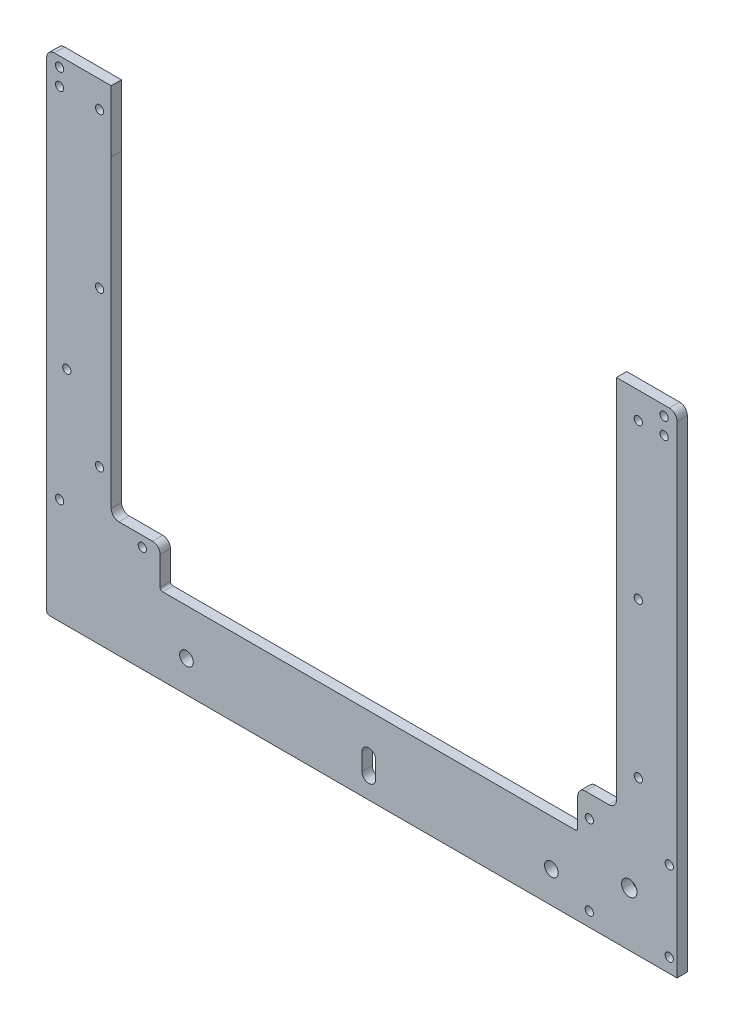
from build123d import *

# Parameters (mm, degrees)
RESSALTO_EXTRUS_O1_DEPTH = 4
FILETE1_R                = 3
M3_CLEARANCE_HOLE1_D     = 3.2
FURO_COM_FOLGA_DE_M32_D  = 2.87
M3_CLEARANCE_HOLE2_D     = 3.2
SKETCH3_W                = 27.430623534
SKETCH3_H                = 190
CUT_EXTRUDE1_DEPTH       = 10
BOSS_EXTRUDE1_DEPTH      = 4
FILLET3_R                = 3
BOSS_EXTRUDE3_DEPTH      = 4
M3_CLEARANCE_HOLE4_D     = 3.2
FILLET5_R                = 3
M5_CLEARANCE_HOLE1_D     = 5.3
SKETCH15_R               = 3
CUT_EXTRUDE6_DEPTH       = 215.251953603
SKETCH17_W               = 196
SKETCH17_H               = 23.942856981
CUT_EXTRUDE8_DEPTH       = 5
M3_CLEARANCE_HOLE6_D     = 3.2
M3_CLEARANCE_HOLE5_D     = 3.2
CUT_EXTRUDE9_DEPTH       = 4


with BuildPart() as part:
    # Esboço1 → Ressalto-extrusão1 (new body)
    with BuildSketch(Plane.XY):
        with BuildLine():
            Line((168.243612151, -138.115636704), (-79.756387849, -138.115636704))
            ThreePointArc((-79.756387849, -138.115636704), (-80.46349463, -137.822743485), (-80.756387849, -137.115636704))
            Line((-80.756387849, -137.115636704), (-80.756387849, 48.884363296))
            ThreePointArc((-80.756387849, 48.884363296), (-79.877708192, 51.005683639), (-77.756387849, 51.884363296))
            Line((-77.756387849, 51.884363296), (166.243612151, 51.884363296))
            ThreePointArc((166.243612151, 51.884363296), (168.364932495, 51.005683639), (169.243612151, 48.884363296))
            Line((169.243612151, 48.884363296), (169.243612151, -137.115636704))
            ThreePointArc((169.243612151, -137.115636704), (168.950718933, -137.822743485), (168.243612151, -138.115636704))
        make_face()
        with BuildLine():
            Line((-36.756387849, -93.115636704), (-55.756387849, -93.115636704))
            Line((-55.756387849, -93.115636704), (-55.756387849, -79.115636704))
            Line((-55.756387849, -79.115636704), (-55.756387849, 27.884363296))
            ThreePointArc((-55.756387849, 27.884363296), (-54.877708192, 30.005683639), (-52.756387849, 30.884363296))
            Line((-52.756387849, 30.884363296), (141.243612151, 30.884363296))
            ThreePointArc((141.243612151, 30.884363296), (143.364932495, 30.005683639), (144.243612151, 27.884363296))
            Line((144.243612151, 27.884363296), (144.243612151, -79.115636704))
            Line((144.243612151, -79.115636704), (144.243612151, -93.115636704))
            Line((144.243612151, -93.115636704), (125.243612151, -93.115636704))
            Line((125.243612151, -93.115636704), (125.243612151, -107.115636704))
            ThreePointArc((125.243612151, -107.115636704), (124.950718933, -107.822743485), (124.243612151, -108.115636704))
            Line((124.243612151, -108.115636704), (-35.756387849, -108.115636704))
            ThreePointArc((-35.756387849, -108.115636704), (-36.46349463, -107.822743485), (-36.756387849, -107.115636704))
            Line((-36.756387849, -107.115636704), (-36.756387849, -93.115636704))
        make_face(mode=Mode.SUBTRACT)
    extrude(amount=RESSALTO_EXTRUS_O1_DEPTH)

    # Filete1
    filete1_edges = [part.edges().sort_by_distance(p)[0] for p in [
        (144.243612151, -93.115636704, 2),
        (125.243612151, -93.115636704, 2),
        (-55.756387849, -93.115636704, 2),
        (-36.756387849, -93.115636704, 2),
    ]]
    fillet(filete1_edges, radius=FILETE1_R)

    # M3 Clearance Hole1 (through all)
    with Locations(Plane(origin=(0, 0, 0), x_dir=(-1, 0, 0), z_dir=(0, 0, -1))):
        with Locations((-164.230041881, -97.102981335), (43.669958119, -97.102981335), (75.742817578, -97.102981335)):
            Hole(M3_CLEARANCE_HOLE1_D / 2)

    # Furo com folga de M32 (through all)
    with Locations(Plane.XY.offset(4)):
        with Locations((44.243612151, 46.98714614)):
            Hole(FURO_COM_FOLGA_DE_M32_D / 2)

    # M3 Clearance Hole2 (through all)
    with Locations(Plane.XY.offset(4)):
        with Locations((161.560317261, 35.480164232), (161.560317261, 4.480164232)):
            Hole(M3_CLEARANCE_HOLE2_D / 2)

    # Sketch3 → Cut-Extrude1 (cut)
    with BuildSketch(Plane.XY.offset(4)):
        with Locations((169.958923918, -43.115636704)):
            Rectangle(SKETCH3_W, SKETCH3_H)
    extrude(amount=-CUT_EXTRUDE1_DEPTH, mode=Mode.SUBTRACT)

    # Sketch5 → Boss-Extrude1 (add)
    with BuildSketch(Plane(origin=(0, 0, 0), x_dir=(-1, 0, 0), z_dir=(0, 0, -1))):
        with BuildLine():
            Line((-145.240285588, -97.500155699), (-140.243612151, -97.500155699))
            Line((-140.243612151, -97.500155699), (-140.243612151, 27.941506315))
            ThreePointArc((-140.243612151, 27.941506315), (-139.345176524, 30.025791447), (-137.244156422, 30.884363296))
            Line((-137.244156422, 30.884363296), (-145.240285588, 30.884363296))
            Line((-145.240285588, 30.884363296), (-145.240285588, -97.500155699))
        make_face()
    extrude(amount=-BOSS_EXTRUDE1_DEPTH)

    # Fillet3
    fillet3_edges = [part.edges().sort_by_distance(p)[0] for p in [
        (156.243612151, 51.884363296, 2),
    ]]
    fillet(fillet3_edges, radius=FILLET3_R)

    # Sketch10 → Boss-Extrude3 (add)
    with BuildSketch(Plane(origin=(0, 0, 0), x_dir=(-1, 0, 0), z_dir=(0, 0, -1))):
        with BuildLine():
            Line((-156.243612151, -138.115636704), (-156.243612151, 48.884363296))
            ThreePointArc((-156.243612151, 48.884363296), (-155.364932495, 51.005683639), (-153.243612151, 51.884363296))
            Line((-153.243612151, 51.884363296), (-163.743612151, 51.884363296))
            Line((-163.743612151, 51.884363296), (-163.743612151, -138.115636704))
            Line((-163.743612151, -138.115636704), (-156.243612151, -138.115636704))
        make_face()
    extrude(amount=-BOSS_EXTRUDE3_DEPTH)

    # M3 Clearance Hole4 (through all)
    with Locations(Plane(origin=(0, 0, 0), x_dir=(-1, 0, 0), z_dir=(0, 0, -1))):
        with Locations((-160.743612151, -101.615636704), (-160.743612151, -132.615636704), (-129.743612151, -132.615636704), (-129.743612151, -101.615636704)):
            Hole(M3_CLEARANCE_HOLE4_D / 2)

    # Fillet5
    fillet5_edges = [part.edges().sort_by_distance(p)[0] for p in [
        (163.743612151, 51.884363296, 2),
        (140.243612151, -93.115636704, 2),
    ]]
    fillet(fillet5_edges, radius=FILLET5_R)

    # M5 Clearance Hole1 (through all)
    with Locations(Plane(origin=(0, 0, 0), x_dir=(-1, 0, 0), z_dir=(0, 0, -1))):
        with Locations((-115.03361215, -125.8856367), (26.54638785, -125.8856367), (-44.189907873, -129.865636704)):
            Hole(M5_CLEARANCE_HOLE1_D / 2)

    # Sketch15 → Cut-Extrude6 (cut, through all)
    with BuildSketch(Plane(origin=(0, 0, 0), x_dir=(-1, 0, 0), z_dir=(0, 0, -1))):
        with Locations((-145.243612151, -117.115636704)):
            Circle(SKETCH15_R)
    extrude(amount=-CUT_EXTRUDE6_DEPTH, mode=Mode.SUBTRACT)

    # Sketch17 → Cut-Extrude8 (cut)
    with BuildSketch(Plane(origin=(0, 0, 0), x_dir=(-1, 0, 0), z_dir=(0, 0, -1))):
        with Locations((-42.243612151, 39.912934806)):
            Rectangle(SKETCH17_W, SKETCH17_H)
    extrude(amount=-CUT_EXTRUDE8_DEPTH, mode=Mode.SUBTRACT)

    # M3 Clearance Hole6 (through all)
    with Locations(Plane(origin=(0, 0, 0), x_dir=(-1, 0, 0), z_dir=(0, 0, -1))):
        with Locations((-148.743612151, -78.347886704), (-148.743612151, -18.347886704), (-148.743612151, 41.652113296), (60.256387849, 41.652113296), (60.256387849, -18.347886704), (60.256387849, -78.347886704), (72.959751747, -51.945636704)):
            Hole(M3_CLEARANCE_HOLE6_D / 2)

    # M3 Clearance Hole5 (through all)
    with Locations(Plane.XY.offset(4)):
        with Locations((-75.756387849, 41.652113296), (-75.756387849, 48.152113296), (158.743612151, 48.152113296), (158.743612151, 41.652113296)):
            Hole(M3_CLEARANCE_HOLE5_D / 2)

    # Sketch22 → Cut-Extrude9 (cut)
    with BuildSketch(Plane(origin=(0, 0, 0), x_dir=(-1, 0, 0), z_dir=(0, 0, -1))):
        with BuildLine():
            Line((-46.840844325, -129.865636704), (-46.840844325, -123.2156367))
            ThreePointArc((-46.840844325, -123.2156367), (-44.189907873, -120.564700249), (-41.538971422, -123.2156367))
            Line((-41.538971422, -123.2156367), (-41.538971422, -129.865636704))
            ThreePointArc((-41.538971422, -129.865636704), (-44.189907873, -132.516573155), (-46.840844325, -129.865636704))
        make_face()
    extrude(amount=-CUT_EXTRUDE9_DEPTH, mode=Mode.SUBTRACT)


solid = part.part
